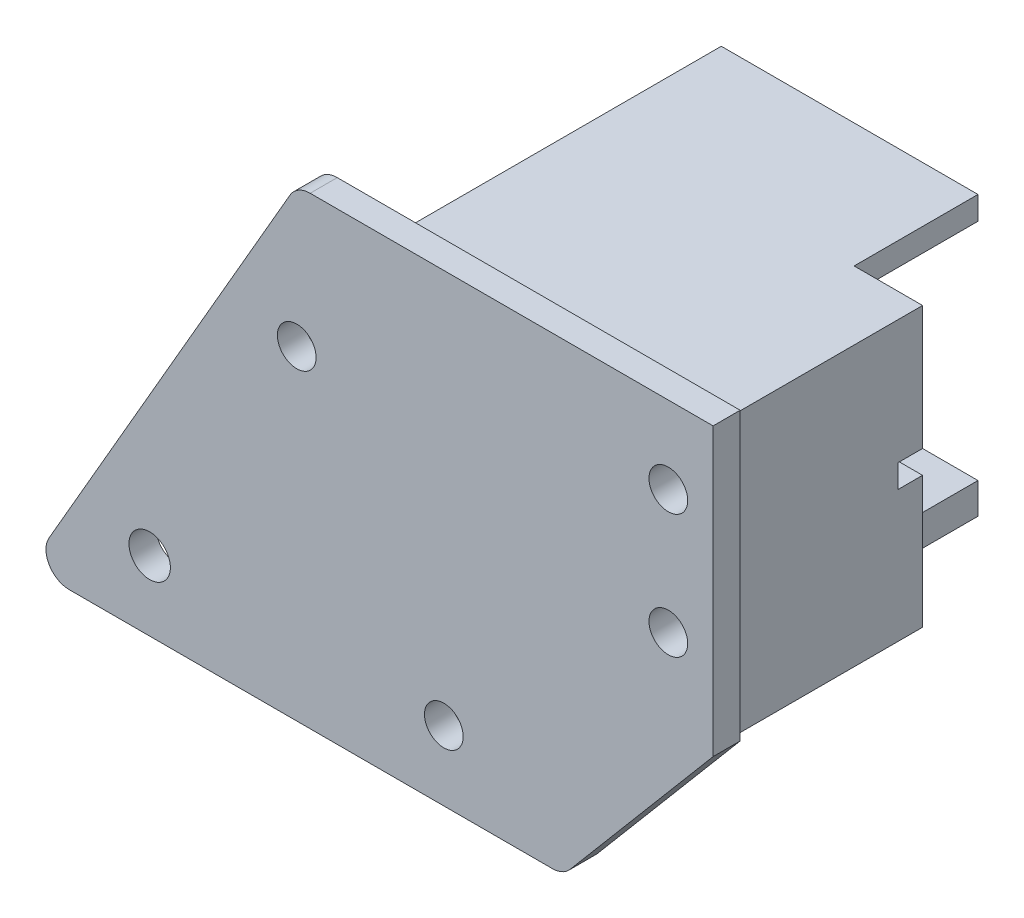
from build123d import *

# Parameters (mm, degrees)
SKETCH1_R           = 2.675
SKETCH1_R_2         = 2.5
BOSS_EXTRUDE1_DEPTH = 3.5
FILLET1_R           = 3
SKETCH2_W           = 8.840351234
SKETCH2_H           = 3
SKETCH2_H_2         = 13
SKETCH2_R           = 2.5
SKETCH2_W_2         = 33.159648766
SKETCH2_R_2         = 4.125
SKETCH2_W_3         = 8.159648766
SKETCH2_H_3         = 4
BOSS_EXTRUDE2_DEPTH = 3.5
SKETCH2_4_W         = 8.840351234
SKETCH2_4_H         = 4
SKETCH2_4_H_2       = 13
SKETCH2_4_R         = 2.5
SKETCH2_4_H_3       = 3
SKETCH2_4_W_2       = 33.159648766
BOSS_EXTRUDE3_DEPTH = 24
FILLET2_R           = 3
SKETCH2_7_W         = 8.840351234
SKETCH2_7_H         = 3
BOSS_EXTRUDE5_DEPTH = 20.8
SKETCH2_9_R         = 2.5
CUT_EXTRUDE3_DEPTH  = 80.12322562
CUT_EXTRUDE1_DEPTH  = 80.12322562
SKETCH2_10_W        = 33.159648766
SKETCH2_10_H        = 3
SKETCH2_10_W_2      = 58.254565561
SKETCH2_10_H_2      = 4
BOSS_EXTRUDE6_DEPTH = 40
BOSS_EXTRUDE7_DEPTH = 15.25


with BuildPart() as part:
    # Sketch1 → Boss-Extrude1 (new body)
    with BuildSketch(Plane.XY):
        Polygon((-32.756938656, -9), (36.243061344, -9), (55.612607206, 13.908965344), (55.612607206, 50.908965344), (1.831518612, 50.908965344), align=None)
        with Locations((-17.168481388, 0)):
            Circle(SKETCH1_R, mode=Mode.SUBTRACT)
        with Locations((20.831518612, 0)):
            Circle(SKETCH1_R_2, mode=Mode.SUBTRACT)
        with Locations((1.831518612, 32.908965344)):
            Circle(SKETCH1_R_2, mode=Mode.SUBTRACT)
    extrude(amount=BOSS_EXTRUDE1_DEPTH)

    # Fillet1
    fillet1_edges = [part.edges().sort_by_distance(p)[0] for p in [
        (36.243061344, -9, 1.75),
        (-32.756938656, -9, 1.75),
        (1.831518612, 50.908965344, 1.75),
    ]]
    fillet(fillet1_edges, radius=FILLET1_R)

    # Sketch2 → Boss-Extrude2 (add)
    # profile 1 of 12: a face of its own
    with BuildSketch(Plane(origin=(0, 0, 0), x_dir=(-1, 0, 0), z_dir=(0, 0, -1))):
        with Locations((-50.751694229, 48.908965344)):
            Rectangle(SKETCH2_W, SKETCH2_H)
    # profile 2 of 12: a face of its own
    with BuildSketch(Plane(origin=(0, 0, 0), x_dir=(-1, 0, 0), z_dir=(0, 0, -1))):
        with Locations((-50.751694229, 40.908965344)):
            Rectangle(SKETCH2_W, SKETCH2_H_2)
        with Locations((-49.831518612, 40.908965344)):
            Circle(SKETCH2_R, mode=Mode.SUBTRACT)
    # profile 3 of 12: a face of its own
    with BuildSketch(Plane(origin=(0, 0, 0), x_dir=(-1, 0, 0), z_dir=(0, 0, -1))):
        with Locations((-29.751694229, 48.908965344)):
            Rectangle(SKETCH2_W_2, SKETCH2_H)
    # profile 4 of 12: a face of its own
    with BuildSketch(Plane(origin=(0, 0, 0), x_dir=(-1, 0, 0), z_dir=(0, 0, -1))):
        Polygon((-13.171869846, 47.408965344), (-46.331518612, 47.408965344), (-46.331518612, 34.408965344), (-46.331518612, 31.408965344), (-46.331518612, 18.408965344), (-13.171869846, 18.408965344), align=None)
    # profile 5 of 12: a face of its own
    with BuildSketch(Plane(origin=(0, 0, 0), x_dir=(-1, 0, 0), z_dir=(0, 0, -1))):
        with Locations((-50.751694229, 32.908965344)):
            Rectangle(SKETCH2_W, SKETCH2_H)
    # profile 6 of 12: a face of its own
    with BuildSketch(Plane(origin=(0, 0, 0), x_dir=(-1, 0, 0), z_dir=(0, 0, -1))):
        Polygon((12.168481388, 47.408965344), (-13.171869846, 47.408965344), (-13.171869846, 18.408965344), (11.923046949, 18.408965344), (12.168481388, 18.408965344), (12.168481388, 31.408965344), (12.168481388, 34.408965344), align=None)
        with Locations((-1.831518612, 32.908965344)):
            Circle(SKETCH2_R_2, mode=Mode.SUBTRACT)
    # profile 7 of 12: a face of its own
    with BuildSketch(Plane(origin=(0, 0, 0), x_dir=(-1, 0, 0), z_dir=(0, 0, -1))):
        with Locations((-50.751694229, 24.908965344)):
            Rectangle(SKETCH2_W, SKETCH2_H_2)
        with Locations((-49.831518612, 24.908965344)):
            Circle(SKETCH2_R, mode=Mode.SUBTRACT)
    # profile 8 of 12: a face of its own
    with BuildSketch(Plane(origin=(0, 0, 0), x_dir=(-1, 0, 0), z_dir=(0, 0, -1))):
        with Locations((16.248305771, 40.908965344)):
            Rectangle(SKETCH2_W_3, SKETCH2_H_2)
        with Locations((16.168481388, 40.908965344)):
            Circle(SKETCH2_R, mode=Mode.SUBTRACT)
    # profile 9 of 12: a face of its own
    with BuildSketch(Plane(origin=(0, 0, 0), x_dir=(-1, 0, 0), z_dir=(0, 0, -1))):
        Polygon((11.923046949, 18.408965344), (-13.171869846, 18.408965344), (-46.331518612, 18.408965344), (-46.331518612, 14.408965344), (11.923046949, 14.408965344), align=None)
    # profile 10 of 12: a face of its own
    with BuildSketch(Plane(origin=(0, 0, 0), x_dir=(-1, 0, 0), z_dir=(0, 0, -1))):
        with Locations((-50.751694229, 16.408965344)):
            Rectangle(SKETCH2_W, SKETCH2_H_3)
    # profile 11 of 12: a face of its own
    with BuildSketch(Plane(origin=(0, 0, 0), x_dir=(-1, 0, 0), z_dir=(0, 0, -1))):
        with Locations((16.248305771, 32.908965344)):
            Rectangle(SKETCH2_W_3, SKETCH2_H)
    # profile 12 of 12: a face of its own
    with BuildSketch(Plane(origin=(0, 0, 0), x_dir=(-1, 0, 0), z_dir=(0, 0, -1))):
        Polygon((20.328130154, 31.408965344), (12.168481388, 31.408965344), (12.168481388, 18.408965344), (16.168481388, 18.408965344), (20.328130154, 18.408965344), align=None)
        with Locations((16.168481388, 24.908965344)):
            Circle(SKETCH2_R, mode=Mode.SUBTRACT)
    extrude(amount=-BOSS_EXTRUDE2_DEPTH)

    # Sketch2<4> → Boss-Extrude3 (add)
    # profile 1 of 6: a face of its own
    with BuildSketch(Plane(origin=(0, 0, 0), x_dir=(-1, 0, 0), z_dir=(0, 0, -1))):
        Polygon((11.923046949, 18.408965344), (-13.171869846, 18.408965344), (-46.331518612, 18.408965344), (-46.331518612, 14.408965344), (11.923046949, 14.408965344), align=None)
    # profile 2 of 6: a face of its own
    with BuildSketch(Plane(origin=(0, 0, 0), x_dir=(-1, 0, 0), z_dir=(0, 0, -1))):
        with Locations((-50.751694229, 16.408965344)):
            Rectangle(SKETCH2_4_W, SKETCH2_4_H)
    # profile 3 of 6: a face of its own
    with BuildSketch(Plane(origin=(0, 0, 0), x_dir=(-1, 0, 0), z_dir=(0, 0, -1))):
        with Locations((-50.751694229, 24.908965344)):
            Rectangle(SKETCH2_4_W, SKETCH2_4_H_2)
        with Locations((-49.831518612, 24.908965344)):
            Circle(SKETCH2_4_R, mode=Mode.SUBTRACT)
    # profile 4 of 6: a face of its own
    with BuildSketch(Plane(origin=(0, 0, 0), x_dir=(-1, 0, 0), z_dir=(0, 0, -1))):
        with Locations((-50.751694229, 40.908965344)):
            Rectangle(SKETCH2_4_W, SKETCH2_4_H_2)
        with Locations((-49.831518612, 40.908965344)):
            Circle(SKETCH2_4_R, mode=Mode.SUBTRACT)
    # profile 5 of 6: a face of its own
    with BuildSketch(Plane(origin=(0, 0, 0), x_dir=(-1, 0, 0), z_dir=(0, 0, -1))):
        with Locations((-50.751694229, 48.908965344)):
            Rectangle(SKETCH2_4_W, SKETCH2_4_H_3)
    # profile 6 of 6: a face of its own
    with BuildSketch(Plane(origin=(0, 0, 0), x_dir=(-1, 0, 0), z_dir=(0, 0, -1))):
        with Locations((-29.751694229, 48.908965344)):
            Rectangle(SKETCH2_4_W_2, SKETCH2_4_H_3)
    extrude(amount=BOSS_EXTRUDE3_DEPTH)

    # Fillet2
    # the kernel refuses this fillet: 3 mm, written as the material it adds along each edge
    with BuildSketch(Plane(origin=(-16.932365136, 18.408965344, 3.5), x_dir=(-0.49999999999999933, -0.8660254037844389, 0), z_dir=(0, 0, -1))) as fillet2_piece_1:
        with BuildLine():
            CenterArc((4.697298716, 3), FILLET2_R, 181.130351539, 88.869648461)
            Line((1.697882509, 2.940818771), (1.637894185, 2.939635146))
            ThreePointArc((1.637894185, 2.939635146), (0.79697973, 1.500409385), (-0.051961524, 0.03))
            Line((-0.051961524, 0.03), (0, -0.06))
            Line((0, -0.06), (4.697298716, -0.06))
            Line((4.697298716, -0.06), (4.697298716, 0))
        make_face()
    extrude(amount=3.5)

    # Sketch2<7> → Boss-Extrude5 (add)
    with BuildSketch(Plane(origin=(0, 0, 0), x_dir=(-1, 0, 0), z_dir=(0, 0, -1))):
        with Locations((-50.751694229, 32.908965344)):
            Rectangle(SKETCH2_7_W, SKETCH2_7_H)
    extrude(amount=BOSS_EXTRUDE5_DEPTH)

    # Sketch2<9> → Cut-Extrude3 (cut, through all)
    with BuildSketch(Plane(origin=(0, 0, 0), x_dir=(-1, 0, 0), z_dir=(0, 0, -1))):
        with Locations((-49.831518612, 40.908965344)):
            Circle(SKETCH2_9_R)
        with Locations((-49.831518612, 24.908965344)):
            Circle(SKETCH2_9_R)
    extrude(amount=-CUT_EXTRUDE3_DEPTH, mode=Mode.SUBTRACT)

    # Sketch3 → Cut-Extrude1 (cut, through all)
    with BuildSketch(Plane(origin=(0, 0, 0), x_dir=(-1, 0, 0), z_dir=(0, 0, -1))):
        Polygon((-1.831518612, 50.908965344), (32.756938656, -9), (32.756938656, 50.908965344), align=None)
    extrude(amount=-CUT_EXTRUDE1_DEPTH, mode=Mode.SUBTRACT)

    # Sketch2<10> → Boss-Extrude6 (add)
    with BuildSketch(Plane(origin=(0, 0, 0), x_dir=(-1, 0, 0), z_dir=(0, 0, -1))):
        with Locations((-29.751694229, 48.908965344)):
            Rectangle(SKETCH2_10_W, SKETCH2_10_H)
        with Locations((-17.204235832, 16.408965344)):
            Rectangle(SKETCH2_10_W_2, SKETCH2_10_H_2)
    extrude(amount=BOSS_EXTRUDE6_DEPTH)

    # Sketch2<11> → Boss-Extrude7 (add)
    with BuildSketch(Plane(origin=(0, 0, 0), x_dir=(-1, 0, 0), z_dir=(0, 0, -1))):
        Polygon((-13.171869846, 47.408965344), (-46.331518612, 47.408965344), (-46.331518612, 34.408965344), (-46.331518612, 31.408965344), (-46.331518612, 18.408965344), (-13.171869846, 18.408965344), align=None)
    extrude(amount=BOSS_EXTRUDE7_DEPTH)


solid = part.part
